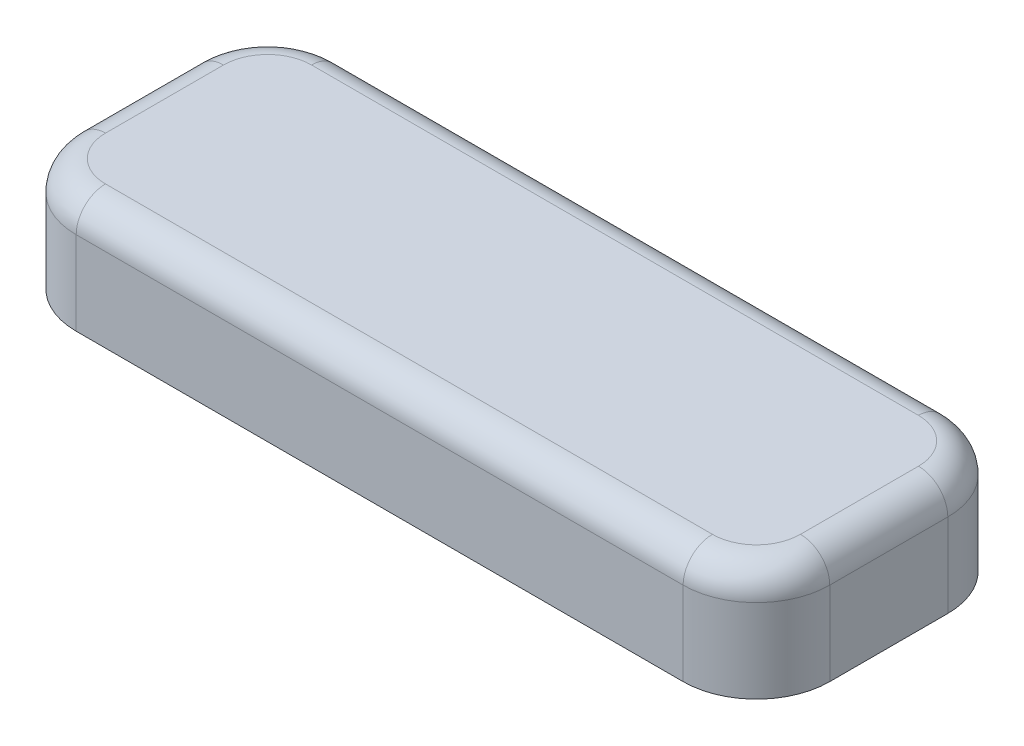
from build123d import *

# Parameters (mm, degrees)
SKETCH_1_R      = 2.8
EXTRUDE_1_DEPTH = 5.5
SKETCH_2_W      = 51.3875
SKETCH_2_H      = 18.05
EXTRUDE_2_DEPTH = 1.2
SKETCH_3_W      = 51.3875
SKETCH_3_H      = 18.05
SKETCH_3_W_2    = 48.9875
SKETCH_3_H_2    = 15.65
EXTRUDE_3_DEPTH = 6.5
FILLET_1_R      = 5
FILLET_2_R      = 2
SKETCH_1_3_R    = 2.8
EXTRUDE_4_DEPTH = 5.5
SKETCH_1_4_R    = 2.8
EXTRUDE_5_DEPTH = 5.5
CHAMFER_3_SIZE  = 0.5


with BuildPart() as part:
    # 草图1 → 凸台-拉伸1 (new body)
    with BuildSketch(Plane(origin=(0, 0, 0), x_dir=(1, 0, 0), z_dir=(0, 1, 0))):
        Circle(SKETCH_1_R)
        Polygon((2.2, 0.6), (2.2, -0.6), (0.6, -0.6), (0.6, -2.2), (-0.6, -2.2), (-0.6, -0.6), (-2.2, -0.6), (-2.2, 0.6), (-0.6, 0.6), (-0.6, 2.2), (0.6, 2.2), (0.6, 0.6), align=None, mode=Mode.SUBTRACT)
    extrude(amount=-EXTRUDE_1_DEPTH)

    # 草图2 → 凸台-拉伸2 (add)
    with BuildSketch(Plane(origin=(0, 0, 0), x_dir=(1, 0, 0), z_dir=(0, 1, 0))):
        Rectangle(SKETCH_2_W, SKETCH_2_H)
    extrude(amount=EXTRUDE_2_DEPTH)

    # 草图3 → 凸台-拉伸3 (add)
    with BuildSketch(Plane(origin=(0, 0, 0), x_dir=(1, 0, 0), z_dir=(0, 1, 0))):
        Rectangle(SKETCH_3_W, SKETCH_3_H)
        Rectangle(SKETCH_3_W_2, SKETCH_3_H_2, mode=Mode.SUBTRACT)
    extrude(amount=-EXTRUDE_3_DEPTH)

    # 圆角1
    fillet_1_edges = [part.edges().sort_by_distance(p)[0] for p in [
        (-25.69375, -2.65, -9.025),
        (25.69375, -2.65, -9.025),
        (25.69375, -2.65, 9.025),
        (-25.69375, -2.65, 9.025),
        (-24.49375, -3.25, -7.825),
        (24.49375, -3.25, -7.825),
        (24.49375, -3.25, 7.825),
        (-24.49375, -3.25, 7.825),
    ]]
    fillet(fillet_1_edges, radius=FILLET_1_R)

    # 圆角2
    fillet_2_edges = [part.edges().sort_by_distance(p)[0] for p in [
        (24.49375, 0, 0),
        (0, 0, 7.825),
        (0, 0, -7.825),
        (-24.49375, 0, 0),
        (24.229283906, 1.2, -7.560533906),
        (25.69375, 1.2, 0),
        (24.229283906, 1.2, 7.560533906),
        (0, 1.2, 9.025),
        (-24.229283906, 1.2, 7.560533906),
        (-25.69375, 1.2, 0),
        (-24.229283906, 1.2, -7.560533906),
        (0, 1.2, -9.025),
        (23.029283906, 0, 6.360533906),
        (23.029283906, 0, -6.360533906),
        (-23.029283906, 0, -6.360533906),
        (-23.029283906, 0, 6.360533906),
    ]]
    fillet(fillet_2_edges, radius=FILLET_2_R)

    # 草图1<3> → 凸台-拉伸4 (add)
    with BuildSketch(Plane(origin=(0, 0, 0), x_dir=(1, 0, 0), z_dir=(0, 1, 0))):
        with Locations((11.90625, 0)):
            Circle(SKETCH_1_3_R)
        Polygon((9.70625, 0.6), (9.70625, -0.6), (11.30625, -0.6), (11.30625, -2.2), (12.50625, -2.2), (12.50625, -0.6), (14.10625, -0.6), (14.10625, 0.6), (12.50625, 0.6), (12.50625, 2.2), (11.30625, 2.2), (11.30625, 0.6), align=None, mode=Mode.SUBTRACT)
    extrude(amount=-EXTRUDE_4_DEPTH)

    # 草图1<4> → 凸台-拉伸5 (add)
    with BuildSketch(Plane(origin=(0, 0, 0), x_dir=(1, 0, 0), z_dir=(0, 1, 0))):
        with Locations((-11.90625, 0)):
            Circle(SKETCH_1_4_R)
        Polygon((-14.10625, -0.6), (-14.10625, 0.6), (-12.50625, 0.6), (-12.50625, 2.2), (-11.30625, 2.2), (-11.30625, 0.6), (-9.70625, 0.6), (-9.70625, -0.6), (-11.30625, -0.6), (-11.30625, -2.2), (-12.50625, -2.2), (-12.50625, -0.6), align=None, mode=Mode.SUBTRACT)
    extrude(amount=-EXTRUDE_5_DEPTH)

    # 倒角3
    chamfer_3_edges = [part.edges().sort_by_distance(p)[0] for p in [
        (-14.70625, 0, 0),
        (-2.8, 0, 0),
        (9.10625, 0, 0),
    ]]
    chamfer(chamfer_3_edges, length=CHAMFER_3_SIZE)


solid = part.part
